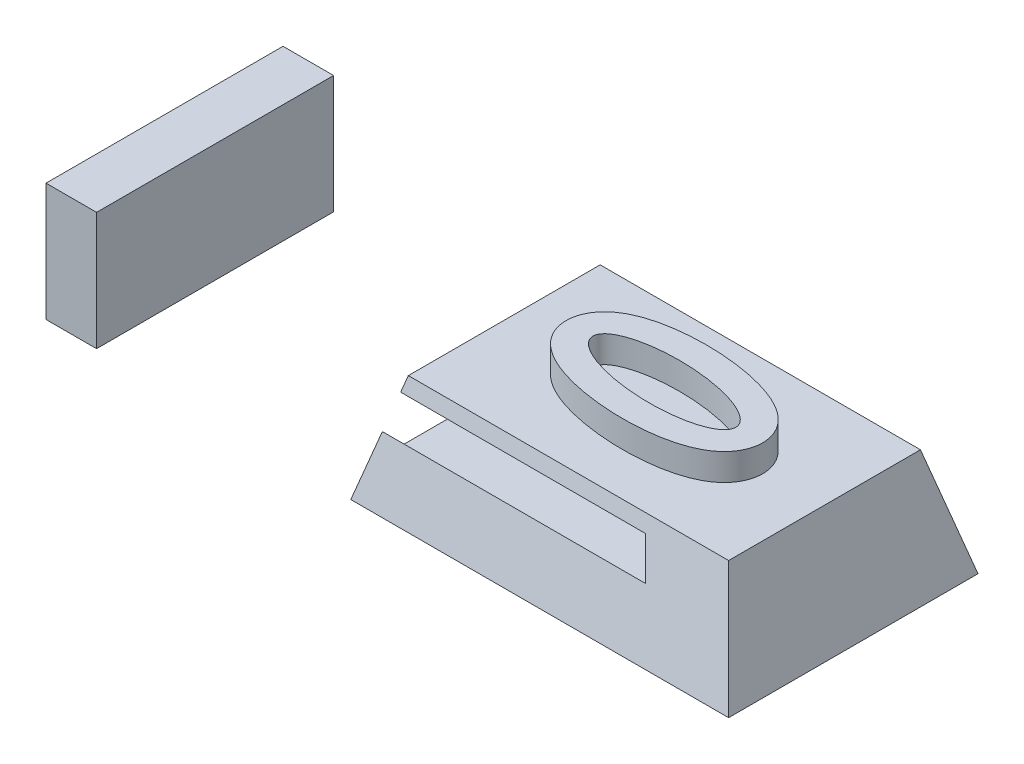
from build123d import *

# Parameters (mm, degrees)
EXTRUDE_THIN2_DEPTH = 10
SKETCH1_W           = 70.384750894
SKETCH1_H           = 46.45393559
BOSS_EXTRUDE1_DEPTH = 20
BOSS_EXTRUDE1_TAPER = 15
SKETCH3_W           = 9.419570306
SKETCH3_H           = 44.154235808
BOSS_EXTRUDE2_DEPTH = 22
SKETCH6_W           = 36.585558134
SKETCH6_H           = 11.890141367
CUT_EXTRUDE3_DEPTH  = 131.353188747
CUT_EXTRUDE5_REACH  = 125.218
SKETCH6_2_W         = 36.585558134
SKETCH6_2_H         = 11.890141367


# Read off the part's stored shape, not the designer's step: Extrude-Thin2
with BuildPart() as part:
    # Extrude-Thin2 outline → Extrude-Thin2 (new body)
    with BuildSketch(Plane(origin=(0, 15, 0), x_dir=(1, 0, 0), z_dir=(0, 1, 0))):
        with BuildLine():
            add(Edge.make_bspline(
                [(-18.998176096, 1.091111465), (-19.026707732, 0.594325331), (-18.999367317, 0.104018854), (-18.83922552, -0.864363457), (-18.703680911, -1.347203381), (-18.3399848, -2.261851117), (-18.112261527, -2.697223431), (-17.707133567, -3.31987619), (-17.561821431, -3.521551229), (-17.256961844, -3.907816675), (-17.096781418, -4.093403121), (-16.595177089, -4.629654759), (-16.232755973, -4.959876356), (-15.461071442, -5.574712302), (-15.054347497, -5.85695505), (-13.805954836, -6.63094112), (-12.927764124, -7.058648253), (-11.566435483, -7.615551307), (-11.103841353, -7.787060437), (-10.174587257, -8.102627564), (-9.707404908, -8.246978438), (-8.299413393, -8.646153824), (-7.35223485, -8.86749584), (-4.490581722, -9.425768365), (-2.556465159, -9.659445057), (1.357293874, -9.887478163), (3.303327245, -9.879702174), (6.200653464, -9.65983033), (7.162906962, -9.55121436), (9.078571867, -9.245294735), (10.032046369, -9.048623919), (11.452718842, -8.65793707), (11.9266494, -8.510746971), (12.85569307, -8.180056561), (13.311644387, -7.996503088), (14.202230408, -7.584108491), (14.636891218, -7.35532283), (15.478877759, -6.83967748), (15.887069074, -6.551358026), (16.643700007, -5.920527822), (16.995248402, -5.576502963), (17.474900792, -5.009513782), (17.627403163, -4.810961371), (17.908706639, -4.404269033), (18.03825758, -4.19541772), (18.393085214, -3.552089081), (18.584867144, -3.101000921), (18.798682542, -2.387741026), (18.857193023, -2.144228508), (18.945701646, -1.658357403), (19.006794174, -1.170307901), (19.013618817, -0.677946444), (18.992794611, -0.183388095), (18.96823576, 0.066297242), (18.854500651, 0.801231602), (18.725987683, 1.27686101), (18.458326403, 1.969941266), (18.355931811, 2.198561706), (18.130515869, 2.640532605), (18.007315595, 2.854681318), (17.741382483, 3.270251415), (17.598643631, 3.47166888), (17.294728923, 3.862490343), (17.132787663, 4.052672698), (16.290405012, 4.963385446), (15.515687177, 5.567111077), (14.257012777, 6.353073628), (13.822653055, 6.593402096), (12.94323625, 7.033551812), (12.496129735, 7.234613427), (11.137127407, 7.792353287), (10.207819429, 8.104282044), (8.788810338, 8.507803751), (8.310544766, 8.631586187), (7.352701557, 8.858171042), (6.872955469, 8.961073581), (4.470557325, 9.429367072), (2.537273087, 9.660774665), (-1.348091277, 9.886730042), (-3.300161897, 9.881397642), (-6.245544824, 9.655679831), (-7.223886131, 9.543762437), (-8.679326473, 9.307773994), (-9.162704785, 9.217644142), (-10.125304394, 9.010429698), (-10.605034859, 8.893160068), (-12.02408202, 8.495857862), (-12.947532321, 8.171409054), (-14.279627464, 7.544682665), (-14.717244368, 7.31039063), (-15.555064148, 6.787865653), (-15.954012351, 6.500823944), (-16.516197897, 6.023463957), (-16.697537387, 5.856523429), (-17.046752813, 5.505255067), (-17.214119751, 5.321239539), (-17.684348837, 4.752778083), (-17.958995408, 4.348692272), (-18.423559979, 3.485739746), (-18.614542316, 3.020985977), (-18.886100797, 2.073730131), (-18.96964446, 1.587897599), (-18.998176096, 1.091111465)],
                knots=[0, 0, 0, 0, 0.015625, 0.015625, 0.03125, 0.03125, 0.046875, 0.046875, 0.0546875, 0.0546875, 0.0625, 0.0625, 0.078125, 0.078125, 0.09375, 0.09375, 0.125, 0.125, 0.140625, 0.140625, 0.15625, 0.15625, 0.1875, 0.1875, 0.25, 0.25, 0.3125, 0.3125, 0.34375, 0.34375, 0.375, 0.375, 0.390625, 0.390625, 0.40625, 0.40625, 0.421875, 0.421875, 0.4375, 0.4375, 0.453125, 0.453125, 0.4609375, 0.4609375, 0.46875, 0.46875, 0.484375, 0.484375, 0.4921875, 0.4921875, 0.5, 0.5078125, 0.5078125, 0.515625, 0.515625, 0.53125, 0.53125, 0.5390625, 0.5390625, 0.546875, 0.546875, 0.5546875, 0.5546875, 0.5625, 0.5625, 0.59375, 0.59375, 0.609375, 0.609375, 0.625, 0.625, 0.65625, 0.65625, 0.671875, 0.671875, 0.6875, 0.6875, 0.75, 0.75, 0.8125, 0.8125, 0.84375, 0.84375, 0.859375, 0.859375, 0.875, 0.875, 0.90625, 0.90625, 0.921875, 0.921875, 0.9375, 0.9375, 0.9453125, 0.9453125, 0.953125, 0.953125, 0.96875, 0.96875, 0.984375, 0.984375, 1, 1, 1, 1], degree=3))
        make_face()
        with BuildLine():
            add(Edge.make_bspline(
                [(14.006401962, -0.804421734), (14.482284092, 7.481525938), (-6.765259916, 4.545184703), (-28.012803925, 1.608843469), (-7.241142046, -3.740762969), (13.530519833, -9.090369406), (14.006401962, -0.804421734)],
                knots=[0, 0, 0, 2.094395102, 2.094395102, 4.188790205, 4.188790205, 6.283185307, 6.283185307, 6.283185307], degree=2, weights=[1, 0.5, 1, 0.5, 1, 0.5, 1]))
        make_face(mode=Mode.SUBTRACT)
    extrude(amount=EXTRUDE_THIN2_DEPTH)

    # Sketch1 → Boss-Extrude1 (add)
    with BuildSketch(Plane(origin=(0, 0, 0), x_dir=(1, 0, 0), z_dir=(0, 1, 0))):
        Rectangle(SKETCH1_W, SKETCH1_H)
    extrude(amount=BOSS_EXTRUDE1_DEPTH, taper=BOSS_EXTRUDE1_TAPER)

    # Sketch6 → Cut-Extrude3 (cut, along a direction that is not the sketch's normal)
    with BuildSketch(Plane(origin=(-83.206204367, 0, 0), x_dir=(0, 0, -1), z_dir=(1, 0, 0))):
        with Locations((-1.99360281, 11.38426496)):
            Rectangle(SKETCH6_W, SKETCH6_H)
    extrude(amount=CUT_EXTRUDE3_DEPTH, dir=(0.9659258262890681, -0.25881904510252135, 0), mode=Mode.SUBTRACT)

    # Cut-Extrude5: up to this plane
    cut_extrude5_end = Plane(origin=(20.703488052, -3.882285677, -23.226967795), z_dir=(0.9659258262890681, 0.25881904510252135, 0))
    # Sketch6<2> → Cut-Extrude5 (cut, up to the surface)
    with BuildSketch(Plane(origin=(-83.206204367, 0, 0), x_dir=(0, 0, -1), z_dir=(1, 0, 0)), mode=Mode.PRIVATE) as cut_extrude5_sk1:
        with Locations((-1.99360281, 11.38426496)):
            Rectangle(SKETCH6_2_W, SKETCH6_2_H)
    cut_extrude5_tool1 = split(extrude(cut_extrude5_sk1.sketch, amount=CUT_EXTRUDE5_REACH, mode=Mode.PRIVATE), bisect_by=cut_extrude5_end, keep=Keep.BOTH, mode=Mode.PRIVATE)
    add(cut_extrude5_tool1.solids().sort_by_distance((-83.206204, 11.384265, 1.993603))[0], mode=Mode.SUBTRACT)


with BuildPart() as body_2:
    # Sketch3 → Boss-Extrude2 (new body)
    with BuildSketch(Plane(origin=(0, 0, 0), x_dir=(1, 0, 0), z_dir=(0, 1, 0))):
        with Locations((-87.91598952, -0.49060262)):
            Rectangle(SKETCH3_W, SKETCH3_H)
    extrude(amount=BOSS_EXTRUDE2_DEPTH)


solid = Compound([part.part, body_2.part])
